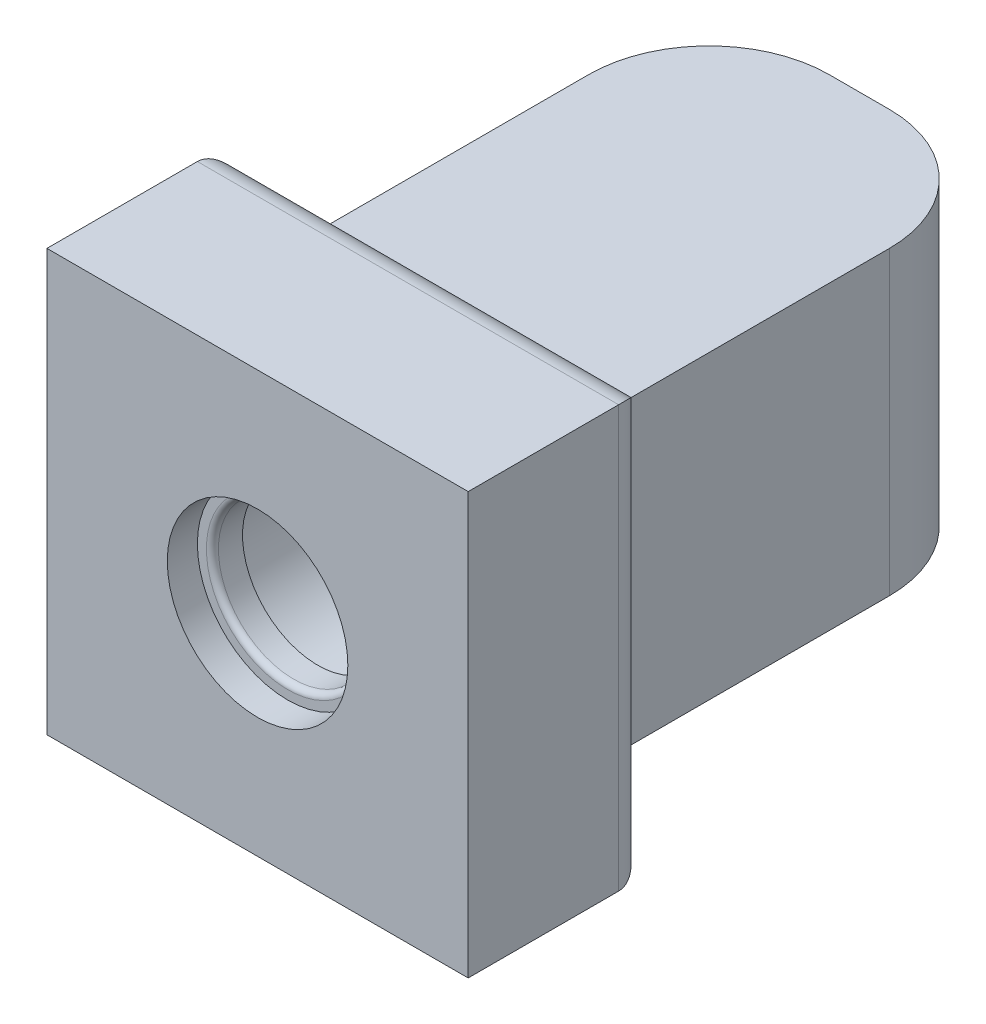
from build123d import *

# Parameters (mm, degrees)
ESQUISSE4_R             = 1.5
BOSS_EXTRU_2_DEPTH      = 5
BOSS_EXTRU_3_START      = -2
ESQUISSE5_R             = 1.5
BOSS_EXTRU_3_DEPTH      = 2
ESQUISSE6_W             = 7
ESQUISSE6_H             = 7
BOSS_EXTRU_4_DEPTH      = 3
CONG_1_R                = 0.5
ESQUISSE7_R             = 1.5
ENL_V_MAT_EXTRU_1_DEPTH = 3
BOSS_EXTRU_5_START      = -0.5
ESQUISSE8_R             = 1.5
ESQUISSE8_R_2           = 1.25
BOSS_EXTRU_5_DEPTH      = 0.5
CONG_2_R                = 0.1


with BuildPart() as part:
    # Esquisse4 → Boss.-Extru.2 (new body)
    with BuildSketch(Plane(origin=(0, 0, 0), x_dir=(1, 0, 0), z_dir=(0, 1, 0))):
        with BuildLine():
            Line((-0.5, 3.5), (0.5, 3.5))
            ThreePointArc((0.5, 3.5), (1.914213562, 2.914213562), (2.5, 1.5))
            Line((2.5, 1.5), (2.5, -3.5))
            Line((2.5, -3.5), (-2.5, -3.5))
            Line((-2.5, -3.5), (-2.5, 1.5))
            ThreePointArc((-2.5, 1.5), (-1.914213562, 2.914213562), (-0.5, 3.5))
        make_face()
        with Locations(Location((0, 0.05, 0), (0, 0, 270))):
            Circle(ESQUISSE4_R, mode=Mode.SUBTRACT)
    extrude(amount=BOSS_EXTRU_2_DEPTH)

    # Esquisse5 → Boss.-Extru.3 (add)
    with BuildSketch(Plane(origin=(0, 5, 0), x_dir=(1, 0, 0), z_dir=(0, 1, 0)).offset(BOSS_EXTRU_3_START)):
        with Locations(Location((0, 0.05, 0), (0, 0, 270))):
            Circle(ESQUISSE5_R)
    extrude(amount=BOSS_EXTRU_3_DEPTH)

    # Esquisse6 → Boss.-Extru.4 (add)
    with BuildSketch(Plane.XY.offset(3.5)):
        with Locations((0, 2.5)):
            Rectangle(ESQUISSE6_W, ESQUISSE6_H)
    extrude(amount=BOSS_EXTRU_4_DEPTH)

    # Congé1
    cong_1_edges = [part.edges().sort_by_distance(p)[0] for p in [
        (2.5, 2.5, 3.5),
        (-2.5, 2.5, 3.5),
        (0, 5, 3.5),
        (-3.5, 2.5, 3.5),
        (0, -1, 3.5),
        (3.5, 2.5, 3.5),
        (0, 6, 3.5),
        (0, 0, 3.5),
    ]]
    fillet(cong_1_edges, radius=CONG_1_R - 0.0001)  # a hair under: the kernel refuses the full size

    # Esquisse7 → Enlèv. mat.-Extru.1 (cut)
    with BuildSketch(Plane.XY.offset(6.5)):
        with Locations((0, 2.5)):
            Circle(ESQUISSE7_R)
    extrude(amount=-ENL_V_MAT_EXTRU_1_DEPTH, mode=Mode.SUBTRACT)

    # Esquisse8 → Boss.-Extru.5 (add)
    with BuildSketch(Plane.XY.offset(6.5).offset(BOSS_EXTRU_5_START)):
        with Locations((0, 2.5)):
            Circle(ESQUISSE8_R)
        with Locations((0, 2.5)):
            Circle(ESQUISSE8_R_2, mode=Mode.SUBTRACT)
    extrude(amount=-BOSS_EXTRU_5_DEPTH)

    # Congé2
    cong_2_edges = [part.edges().sort_by_distance(p)[0] for p in [
        (-1.25, 2.5, 6),
    ]]
    fillet(cong_2_edges, radius=CONG_2_R)


solid = part.part
